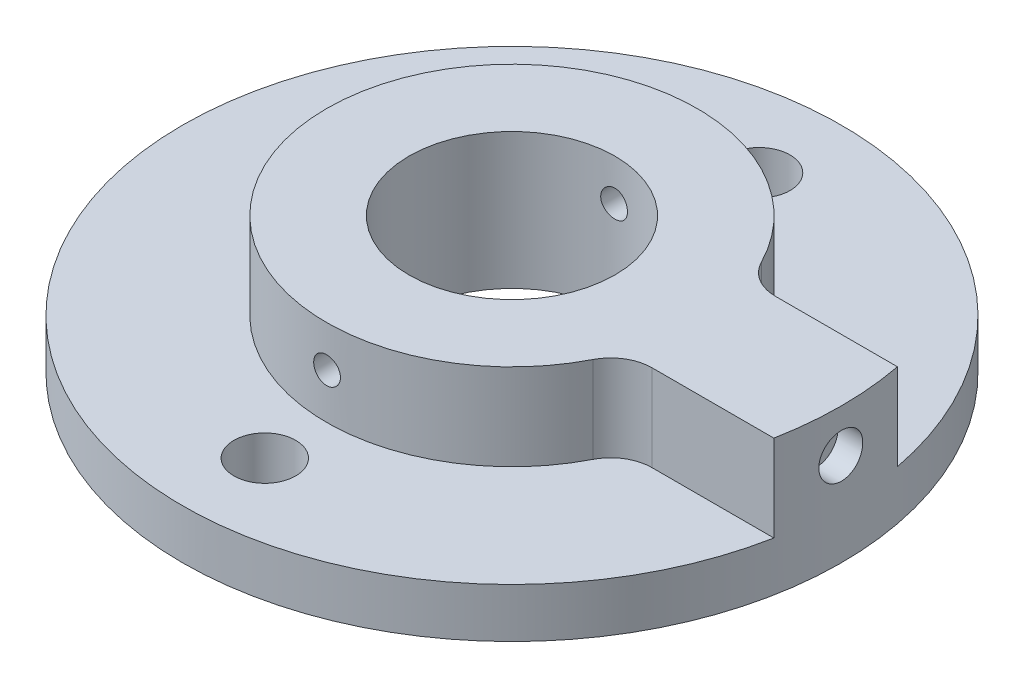
from build123d import *

# Parameters (mm, degrees)
SKETCH_1_R               = 80
EXTRUDE_1_DEPTH          = 12
SKETCH_1_3_R             = 45
SKETCH_1_3_R_2           = 25
EXTRUDE_2_DEPTH          = 33
CUT_EXTRUDE_2_DEPTH      = 118.851601601
CUT_EXTRUDE_2_DEPTH_BACK = 118.851601601
SKETCH_1_4_R             = 25
SKETCH_3_R               = 7.5
CUT_EXTRUDE_3_DEPTH      = 116.06954419
CUT_EXTRUDE_4_DEPTH      = 118.851601601
CUT_EXTRUDE_4_DEPTH_BACK = 118.851601601
SKETCH_4_R               = 3.25
EXTRUDE_3_DEPTH          = 21
FILLET_1_R               = 10
CUT_EXTRUDE_START        = 73.821646461
CUT_EXTRUDE_5_DEPTH      = 7.178353539
CUT_EXTRUDE_START_2      = 16
CUT_EXTRUDE_5_2_DEPTH    = 13
CUT_EXTRUDE_9_REACH      = 119.852
CUT_EXTRUDE_9_END_RADIUS = 80


with BuildPart() as part:
    # 草图1 → 凸台-拉伸1 (new body)
    with BuildSketch(Plane(origin=(0, 0, 0), x_dir=(1, 0, 0), z_dir=(0, 1, 0))):
        with Locations(Location((0, 0, 0), (0, 0, 270))):
            Circle(SKETCH_1_R)
    extrude(amount=EXTRUDE_1_DEPTH)

    # 草图1<3> → 凸台-拉伸2 (add)
    with BuildSketch(Plane(origin=(0, 0, 0), x_dir=(1, 0, 0), z_dir=(0, 1, 0))):
        with Locations(Location((0, 0, 0), (0, 0, 270))):
            Circle(SKETCH_1_3_R)
        with Locations(Location((0, 0, 0), (0, 0, 270))):
            Circle(SKETCH_1_3_R_2, mode=Mode.SUBTRACT)
    extrude(amount=EXTRUDE_2_DEPTH)

    # 草图1<4> → 切除-拉伸2 (cut, two sides: drawn at the far end of the back side and taken through both)
    with BuildSketch(Plane(origin=(0, 0, 0), x_dir=(1, 0, 0), z_dir=(0, 1, 0)).offset(-CUT_EXTRUDE_2_DEPTH_BACK)):
        with Locations(Location((0, 0, 0), (0, 0, 270))):
            Circle(SKETCH_1_4_R)
    extrude(amount=CUT_EXTRUDE_2_DEPTH + CUT_EXTRUDE_2_DEPTH_BACK, mode=Mode.SUBTRACT)

    # 草图3 → 切除-拉伸3 (cut, through all)
    with BuildSketch(Plane(origin=(0, 12, 0), x_dir=(1, 0, 0), z_dir=(0, 1, 0))):
        with Locations(Location((0, 60, 0), (0, 0, 270))):
            Circle(SKETCH_3_R)
        with Locations(Location((0, -60, 0), (0, 0, 270))):
            Circle(SKETCH_3_R)
    extrude(amount=-CUT_EXTRUDE_3_DEPTH, mode=Mode.SUBTRACT)

    # 草图4 → 切除-拉伸4 (cut, two sides: drawn at the far end of the back side and taken through both)
    with BuildSketch(Plane.XY.offset(-CUT_EXTRUDE_4_DEPTH_BACK)):
        with Locations((0, 23)):
            Circle(SKETCH_4_R)
    extrude(amount=CUT_EXTRUDE_4_DEPTH + CUT_EXTRUDE_4_DEPTH_BACK, mode=Mode.SUBTRACT)

    # 草图6 → 凸台-拉伸3 (add)
    with BuildSketch(Plane(origin=(0, 12, 0), x_dir=(1, 0, 0), z_dir=(0, 1, 0))):
        with BuildLine():
            ThreePointArc((42.426406871, 15), (44.351935184, 7.609589043), (45, 0))
            Line((45, 0), (80, 0))
            ThreePointArc((80, 0), (79.64450219, 7.533476681), (78.581168228, 15))
            Line((78.581168228, 15), (42.426406871, 15))
        make_face()
        with BuildLine():
            Line((80, 0), (45, 0))
            ThreePointArc((45, 0), (44.351935184, -7.609589043), (42.426406871, -15))
            Line((42.426406871, -15), (78.581168228, -15))
            ThreePointArc((78.581168228, -15), (79.64450219, -7.533476681), (80, 0))
        make_face()
    extrude(amount=EXTRUDE_3_DEPTH)

    # 圆角1
    fillet_1_edges = [part.edges().sort_by_distance(p)[0] for p in [
        (42.426406871, 22.5, 15),
        (42.426406871, 22.5, -15),
    ]]
    fillet(fillet_1_edges, radius=FILLET_1_R)

    # 切除-拉伸5: read off the stored shape, not the designer's step
    # 切除-拉伸5 outline → 切除-拉伸5 (cut)
    with BuildSketch(Plane(origin=(0, 0, 0), x_dir=(0, 0, -1), z_dir=(1, 0, 0)).offset(CUT_EXTRUDE_START)):
        with BuildLine():
            add(Edge.make_bspline(
                [(-5.338983078, 22.5), (-5.338983078, 21.088703826), (-4.759775949, 19.709126885), (-2.789970131, 17.739694705), (-1.396039111, 17.161767053), (1.390295629, 17.160268335), (2.776177958, 17.726669289), (4.77067497, 19.719260807), (5.338481287, 21.104216537), (5.339484178, 23.891942041), (4.762391942, 25.286161316), (2.795373983, 27.256990244), (1.41465075, 27.837582336), (-1.404057944, 27.840378566), (-2.786176586, 27.262719547), (-4.758291506, 25.293732162), (-5.338983078, 23.911296174), (-5.338983078, 22.5)],
                knots=[0, 0, 0, 0, 0.125, 0.125, 0.25, 0.25, 0.375, 0.375, 0.5, 0.5, 0.625, 0.625, 0.75, 0.75, 0.875, 0.875, 1, 1, 1, 1], degree=3))
        make_face()
    extrude(amount=CUT_EXTRUDE_5_DEPTH, mode=Mode.SUBTRACT)

    # Cut-Extrude 5 2 outline → Cut-Extrude 5 2 (add)
    with BuildSketch(Plane(origin=(0, 0, 0), x_dir=(1, 0, 0), z_dir=(0, 1, 0)).offset(CUT_EXTRUDE_START_2)):
        with BuildLine():
            ThreePointArc((73.821646533, -5.338983493), (74, -1.64e-07), (73.821646555, 5.338983165))
            Line((73.821646555, 5.338983165), (73.821646533, -5.338983493))
        make_face()
    extrude(amount=CUT_EXTRUDE_5_2_DEPTH)

    # 切除-拉伸9: up to this cylinder (the profile starts inside it)
    cut_extrude_9_end = Plane(origin=(-6, 22.5, 0), z_dir=(0, -1, 0)) * Cylinder(CUT_EXTRUDE_9_END_RADIUS, 400.704, mode=Mode.PRIVATE)
    # 草图8<6> → 切除-拉伸9 (cut, up to the surface)
    with BuildSketch(Plane(origin=(0, 0, 0), x_dir=(0, 0, -1), z_dir=(1, 0, 0)), mode=Mode.PRIVATE) as cut_extrude_9_sk1:
        with BuildLine():
            Line((0, 20.21230794), (0, 22.5))
            Line((0, 22.5), (0, 24.78769206))
            ThreePointArc((0, 24.78769206), (-2.28769206, 22.5), (0, 20.21230794))
        make_face()
    cut_extrude_9_tool1 = extrude(cut_extrude_9_sk1.sketch, amount=CUT_EXTRUDE_9_REACH, mode=Mode.PRIVATE) & cut_extrude_9_end
    add(cut_extrude_9_tool1.solids().sort_by_distance((0, 22.5, 0.970927))[0], mode=Mode.SUBTRACT)
    # 草图8<6> → 切除-拉伸9 (cut, up to the surface)
    with BuildSketch(Plane(origin=(0, 0, 0), x_dir=(0, 0, -1), z_dir=(1, 0, 0)), mode=Mode.PRIVATE) as cut_extrude_9_sk2:
        with BuildLine():
            Line((0, 24.78769206), (0, 22.5))
            Line((0, 22.5), (0, 20.21230794))
            ThreePointArc((0, 20.21230794), (1.617642569, 20.882357431), (2.28769206, 22.5))
            ThreePointArc((2.28769206, 22.5), (1.617642569, 24.117642569), (0, 24.78769206))
        make_face()
    cut_extrude_9_tool2 = extrude(cut_extrude_9_sk2.sketch, amount=CUT_EXTRUDE_9_REACH, mode=Mode.PRIVATE) & cut_extrude_9_end
    add(cut_extrude_9_tool2.solids().sort_by_distance((0, 22.5, -0.970927))[0], mode=Mode.SUBTRACT)
    # 草图8<6> → 切除-拉伸9 (cut, up to the surface)
    with BuildSketch(Plane(origin=(0, 0, 0), x_dir=(0, 0, -1), z_dir=(1, 0, 0)), mode=Mode.PRIVATE) as cut_extrude_9_sk3:
        with BuildLine():
            Line((0, 20.21230794), (0, 22.5))
            Line((0, 22.5), (0, 24.78769206))
            ThreePointArc((0, 24.78769206), (-2.28769206, 22.5), (0, 20.21230794))
        make_face()
    cut_extrude_9_tool3 = extrude(cut_extrude_9_sk3.sketch, amount=CUT_EXTRUDE_9_REACH, mode=Mode.PRIVATE) & cut_extrude_9_end
    add(cut_extrude_9_tool3.solids().sort_by_distance((0, 22.5, 0.970927))[0], mode=Mode.SUBTRACT)
    # 草图8<6> → 切除-拉伸9 (cut, up to the surface)
    with BuildSketch(Plane(origin=(0, 0, 0), x_dir=(0, 0, -1), z_dir=(1, 0, 0)), mode=Mode.PRIVATE) as cut_extrude_9_sk4:
        with BuildLine():
            Line((0, 24.78769206), (0, 22.5))
            Line((0, 22.5), (0, 20.21230794))
            ThreePointArc((0, 20.21230794), (1.617642569, 20.882357431), (2.28769206, 22.5))
            ThreePointArc((2.28769206, 22.5), (1.617642569, 24.117642569), (0, 24.78769206))
        make_face()
    cut_extrude_9_tool4 = extrude(cut_extrude_9_sk4.sketch, amount=CUT_EXTRUDE_9_REACH, mode=Mode.PRIVATE) & cut_extrude_9_end
    add(cut_extrude_9_tool4.solids().sort_by_distance((0, 22.5, -0.970927))[0], mode=Mode.SUBTRACT)


solid = part.part
